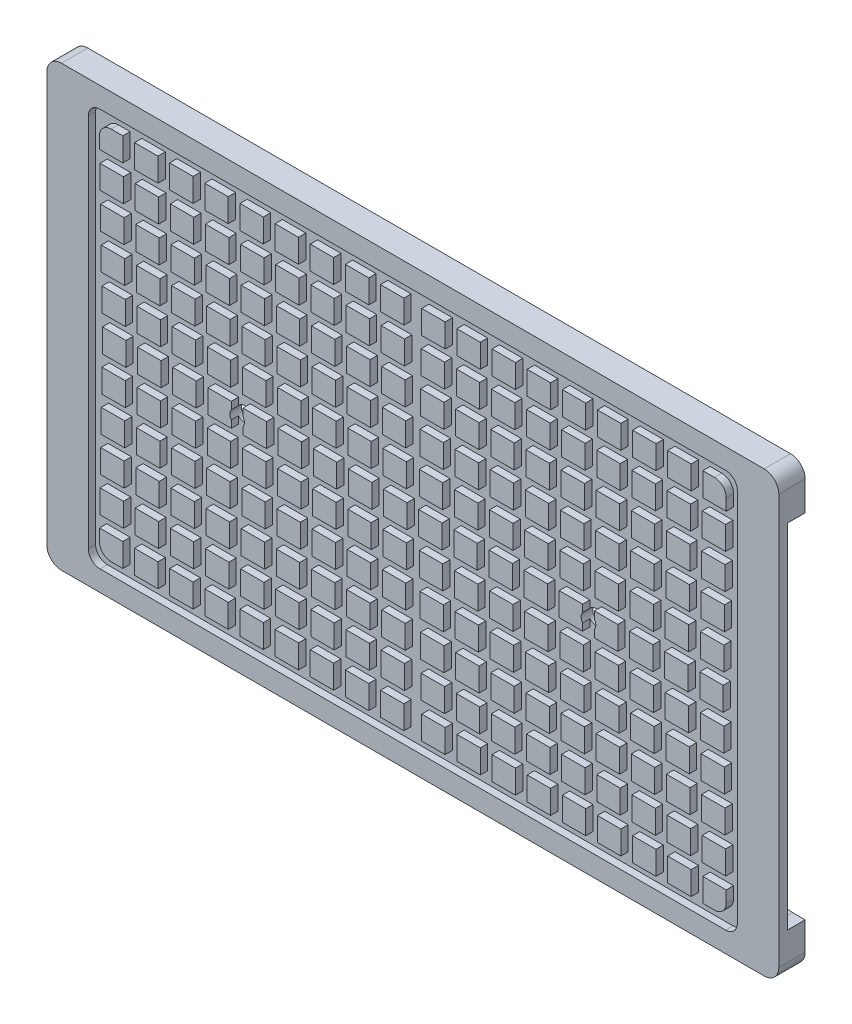
from build123d import *
from build123d.topology import SkipClean

# Parameters (mm, degrees)
EXTRUDE_1_DEPTH     = 9
EXTRUDE_2_DEPTH     = 0.6
CUT_EXTRUDE_1_DEPTH = 6
SKETCH_5_R          = 2.25
CUT_EXTRUDE_2_DEPTH = 15
SKETCH_7_R          = 2.5
CUT_EXTRUDE_3_DEPTH = 15
SKETCH_8_R          = 2.5
CUT_EXTRUDE_4_DEPTH = 5
CUT_EXTRUDE_START   = -2.5
SKETCH_9_W          = 8
SKETCH_9_H          = 8
CUT_EXTRUDE_5_DEPTH = 2.5
SKETCH_10_R         = 1.25
CUT_EXTRUDE_6_DEPTH = 6.5


with BuildPart() as part:
    # 草图2 → 凸台-拉伸1 (new body)
    with BuildSketch(Plane.XY):
        with BuildLine():
            Line((-120, 75), (120, 75))
            ThreePointArc((120, 75), (123.535533906, 73.535533906), (125, 70))
            Line((125, 70), (125, -70))
            ThreePointArc((125, -70), (123.535533906, -73.535533906), (120, -75))
            Line((120, -75), (-120, -75))
            ThreePointArc((-120, -75), (-123.535533906, -73.535533906), (-125, -70))
            Line((-125, -70), (-125, 70))
            ThreePointArc((-125, 70), (-123.535533906, 73.535533906), (-120, 75))
        make_face()
    extrude(amount=EXTRUDE_1_DEPTH)

    # 草图3 → 凸台-拉伸2 (add)
    with BuildSketch(Plane(origin=(0, 0, 0), x_dir=(-1, 0, 0), z_dir=(0, 0, -1))):
        with BuildLine():
            Line((-99.253334042, 67), (99.253334042, 67))
            ThreePointArc((99.253334042, 67), (104.731054073, 64.731054073), (107, 59.253334042))
            Line((107, 59.253334042), (107, -59.253334042))
            ThreePointArc((107, -59.253334042), (104.731054073, -64.731054073), (99.253334042, -67))
            Line((99.253334042, -67), (-99.253334042, -67))
            ThreePointArc((-99.253334042, -67), (-104.731054073, -64.731054073), (-107, -59.253334042))
            Line((-107, -59.253334042), (-107, 59.253334042))
            ThreePointArc((-107, 59.253334042), (-104.731054073, 64.731054073), (-99.253334042, 67))
        make_face()
        with BuildLine():
            Line((-99.253334042, 65), (99.253334042, 65))
            ThreePointArc((99.253334042, 65), (103.31684051, 63.31684051), (105, 59.253334042))
            Line((105, 59.253334042), (105, -59.253334042))
            ThreePointArc((105, -59.253334042), (103.31684051, -63.31684051), (99.253334042, -65))
            Line((99.253334042, -65), (-99.253334042, -65))
            ThreePointArc((-99.253334042, -65), (-103.31684051, -63.31684051), (-105, -59.253334042))
            Line((-105, -59.253334042), (-105, 59.253334042))
            ThreePointArc((-105, 59.253334042), (-103.31684051, 63.31684051), (-99.253334042, 65))
        make_face(mode=Mode.SUBTRACT)
    extrude(amount=EXTRUDE_2_DEPTH)

    # 草图4 → 切除-拉伸1 (cut)
    with BuildSketch(Plane(origin=(0, 0, 0), x_dir=(-1, 0, 0), z_dir=(0, 0, -1))):
        with BuildLine():
            Line((125, -60.380854599), (120.746665958, -60.380854599))
            ThreePointArc((120.746665958, -60.380854599), (116.68315949, -58.697695109), (115, -54.634188641))
            Line((115, -54.634188641), (115, 54.253334042))
            ThreePointArc((115, 54.253334042), (116.68315949, 58.31684051), (120.746665958, 60))
            Line((120.746665958, 60), (125, 60))
            Line((125, 60), (125, -60.380854599))
        make_face()
        with BuildLine():
            Line((-115, -54.634188641), (-115, 54.253334042))
            ThreePointArc((-115, 54.253334042), (-116.68315949, 58.31684051), (-120.746665958, 60))
            Line((-120.746665958, 60), (-125, 60))
            Line((-125, 60), (-125, -60.380854599))
            Line((-125, -60.380854599), (-120.746665958, -60.380854599))
            ThreePointArc((-120.746665958, -60.380854599), (-116.68315949, -58.697695109), (-115, -54.634188641))
        make_face()
    extrude(amount=-CUT_EXTRUDE_1_DEPTH, mode=Mode.SUBTRACT)

    # 草图5 → 切除-拉伸2 (cut)
    with BuildSketch(Plane.XZ.offset(75)):
        with Locations((-15, 3.5)):
            Circle(SKETCH_5_R)
        with Locations((15, 3.5)):
            Circle(SKETCH_5_R)
    extrude(amount=-CUT_EXTRUDE_2_DEPTH, mode=Mode.SUBTRACT)

    # 草图7 → 切除-拉伸3 (cut)
    with BuildSketch(Plane(origin=(0, 0, 0), x_dir=(-1, 0, 0), z_dir=(0, 0, -1))):
        with Locations((60, 0)):
            Circle(SKETCH_7_R)
        with Locations((-60, 0)):
            Circle(SKETCH_7_R)
    extrude(amount=-CUT_EXTRUDE_3_DEPTH, mode=Mode.SUBTRACT)

    # 草图8 → 切除-拉伸4 (cut)
    with BuildSketch(Plane(origin=(0, 0, 0), x_dir=(-1, 0, 0), z_dir=(0, 0, -1))):
        with BuildLine():
            Line((100, 60), (-95, 60))
            ThreePointArc((-95, 60), (-98.535533906, 58.535533906), (-100, 55))
            Line((-100, 55), (-100, -55))
            ThreePointArc((-100, -55), (-98.535533906, -58.535533906), (-95, -60))
            Line((-95, -60), (95, -60))
            ThreePointArc((95, -60), (98.535533906, -58.535533906), (100, -55))
            Line((100, -55), (100, 60))
        make_face()
        with Locations((-60, 0)):
            Circle(SKETCH_8_R, mode=Mode.SUBTRACT)
        with Locations((60, 0)):
            Circle(SKETCH_8_R, mode=Mode.SUBTRACT)
    extrude(amount=-CUT_EXTRUDE_4_DEPTH, mode=Mode.SUBTRACT)

    # 草图9 → 切除-拉伸5 (cut)
    with SkipClean():  # the faces are left unmerged after this step: merging them gives an invalid solid
        with BuildSketch(Plane.XY.offset(9).offset(CUT_EXTRUDE_START)):
            with BuildLine():
                Line((106.837715509, 67.990861709), (-106.837715509, 67.990861709))
                ThreePointArc((-106.837715509, 67.990861709), (-109.666142634, 66.819288834), (-110.837715509, 63.990861709))
                Line((-110.837715509, 63.990861709), (-110.837715509, -63.990861709))
                ThreePointArc((-110.837715509, -63.990861709), (-109.666142634, -66.819288834), (-106.837715509, -67.990861709))
                Line((-106.837715509, -67.990861709), (106.837715509, -67.990861709))
                ThreePointArc((106.837715509, -67.990861709), (109.666142634, -66.819288834), (110.837715509, -63.990861709))
                Line((110.837715509, -63.990861709), (110.837715509, 63.990861709))
                ThreePointArc((110.837715509, 63.990861709), (109.666142634, 66.819288834), (106.837715509, 67.990861709))
            make_face()
            with BuildLine():
                Line((-107.047144386, -59.990861709), (-107.047144386, -55.990861709))
                Line((-107.047144386, -55.990861709), (-99.047144386, -55.990861709))
                Line((-99.047144386, -55.990861709), (-99.047144386, -63.990861709))
                Line((-99.047144386, -63.990861709), (-103.047144386, -63.990861709))
                ThreePointArc((-103.047144386, -63.990861709), (-105.875571511, -62.819288834), (-107.047144386, -59.990861709))
            make_face(mode=Mode.SUBTRACT)
            with Locations((-91.047144386, -59.990861709)):
                Rectangle(SKETCH_9_W, SKETCH_9_H, mode=Mode.SUBTRACT)
            with Locations((-79.047144386, -59.990861709)):
                Rectangle(SKETCH_9_W, SKETCH_9_H, mode=Mode.SUBTRACT)
            with Locations((-67.047144386, -59.990861709)):
                Rectangle(SKETCH_9_W, SKETCH_9_H, mode=Mode.SUBTRACT)
            with Locations((-102.837715509, -47.992689368)):
                Rectangle(SKETCH_9_W, SKETCH_9_H, mode=Mode.SUBTRACT)
            with Locations((-90.837715509, -47.992689368)):
                Rectangle(SKETCH_9_W, SKETCH_9_H, mode=Mode.SUBTRACT)
            with Locations((-102.628286632, -35.994517026)):
                Rectangle(SKETCH_9_W, SKETCH_9_H, mode=Mode.SUBTRACT)
            with Locations((-90.628286632, -35.994517026)):
                Rectangle(SKETCH_9_W, SKETCH_9_H, mode=Mode.SUBTRACT)
            with Locations((-78.837715509, -47.992689368)):
                Rectangle(SKETCH_9_W, SKETCH_9_H, mode=Mode.SUBTRACT)
            with Locations((-66.837715509, -47.992689368)):
                Rectangle(SKETCH_9_W, SKETCH_9_H, mode=Mode.SUBTRACT)
            with Locations((-78.628286632, -35.994517026)):
                Rectangle(SKETCH_9_W, SKETCH_9_H, mode=Mode.SUBTRACT)
            with Locations((-66.628286632, -35.994517026)):
                Rectangle(SKETCH_9_W, SKETCH_9_H, mode=Mode.SUBTRACT)
            with Locations((-55.047144386, -59.990861709)):
                Rectangle(SKETCH_9_W, SKETCH_9_H, mode=Mode.SUBTRACT)
            with Locations((-43.047144386, -59.990861709)):
                Rectangle(SKETCH_9_W, SKETCH_9_H, mode=Mode.SUBTRACT)
            with Locations((-31.047144386, -59.990861709)):
                Rectangle(SKETCH_9_W, SKETCH_9_H, mode=Mode.SUBTRACT)
            with Locations((-19.047144386, -59.990861709)):
                Rectangle(SKETCH_9_W, SKETCH_9_H, mode=Mode.SUBTRACT)
            with Locations((-7.047144386, -59.990861709)):
                Rectangle(SKETCH_9_W, SKETCH_9_H, mode=Mode.SUBTRACT)
            with Locations((-54.837715509, -47.992689368)):
                Rectangle(SKETCH_9_W, SKETCH_9_H, mode=Mode.SUBTRACT)
            with Locations((-42.837715509, -47.992689368)):
                Rectangle(SKETCH_9_W, SKETCH_9_H, mode=Mode.SUBTRACT)
            with Locations((-30.837715509, -47.992689368)):
                Rectangle(SKETCH_9_W, SKETCH_9_H, mode=Mode.SUBTRACT)
            with Locations((-54.628286632, -35.994517026)):
                Rectangle(SKETCH_9_W, SKETCH_9_H, mode=Mode.SUBTRACT)
            with Locations((-42.628286632, -35.994517026)):
                Rectangle(SKETCH_9_W, SKETCH_9_H, mode=Mode.SUBTRACT)
            with Locations((-30.628286632, -35.994517026)):
                Rectangle(SKETCH_9_W, SKETCH_9_H, mode=Mode.SUBTRACT)
            with Locations((-18.837715509, -47.992689368)):
                Rectangle(SKETCH_9_W, SKETCH_9_H, mode=Mode.SUBTRACT)
            with Locations((-6.837715509, -47.992689368)):
                Rectangle(SKETCH_9_W, SKETCH_9_H, mode=Mode.SUBTRACT)
            with Locations((-18.628286632, -35.994517026)):
                Rectangle(SKETCH_9_W, SKETCH_9_H, mode=Mode.SUBTRACT)
            with Locations((-6.628286632, -35.994517026)):
                Rectangle(SKETCH_9_W, SKETCH_9_H, mode=Mode.SUBTRACT)
            with Locations((-102.418857754, -23.996344684)):
                Rectangle(SKETCH_9_W, SKETCH_9_H, mode=Mode.SUBTRACT)
            with Locations((-90.418857754, -23.996344684)):
                Rectangle(SKETCH_9_W, SKETCH_9_H, mode=Mode.SUBTRACT)
            with Locations((-78.418857754, -23.996344684)):
                Rectangle(SKETCH_9_W, SKETCH_9_H, mode=Mode.SUBTRACT)
            with Locations((-66.418857754, -23.996344684)):
                Rectangle(SKETCH_9_W, SKETCH_9_H, mode=Mode.SUBTRACT)
            with Locations((-102.209428877, -11.998172342)):
                Rectangle(SKETCH_9_W, SKETCH_9_H, mode=Mode.SUBTRACT)
            with Locations((-90.209428877, -11.998172342)):
                Rectangle(SKETCH_9_W, SKETCH_9_H, mode=Mode.SUBTRACT)
            with Locations((-102, 0)):
                Rectangle(SKETCH_9_W, SKETCH_9_H, mode=Mode.SUBTRACT)
            with Locations((-90, 0)):
                Rectangle(SKETCH_9_W, SKETCH_9_H, mode=Mode.SUBTRACT)
            with Locations((-78.209428877, -11.998172342)):
                Rectangle(SKETCH_9_W, SKETCH_9_H, mode=Mode.SUBTRACT)
            with Locations((-66.209428877, -11.998172342)):
                Rectangle(SKETCH_9_W, SKETCH_9_H, mode=Mode.SUBTRACT)
            with Locations((-78, 0)):
                Rectangle(SKETCH_9_W, SKETCH_9_H, mode=Mode.SUBTRACT)
            with BuildLine():
                Line((-62, -1.5), (-62, -4))
                Line((-62, -4), (-70, -4))
                Line((-70, -4), (-70, 4))
                Line((-70, 4), (-62, 4))
                Line((-62, 4), (-62, 1.5))
                ThreePointArc((-62, 1.5), (-62.5, 0), (-62, -1.5))
            make_face(mode=Mode.SUBTRACT)
            with Locations((-54.418857754, -23.996344684)):
                Rectangle(SKETCH_9_W, SKETCH_9_H, mode=Mode.SUBTRACT)
            with Locations((-42.418857754, -23.996344684)):
                Rectangle(SKETCH_9_W, SKETCH_9_H, mode=Mode.SUBTRACT)
            with Locations((-30.418857754, -23.996344684)):
                Rectangle(SKETCH_9_W, SKETCH_9_H, mode=Mode.SUBTRACT)
            with Locations((-18.418857754, -23.996344684)):
                Rectangle(SKETCH_9_W, SKETCH_9_H, mode=Mode.SUBTRACT)
            with Locations((-6.418857754, -23.996344684)):
                Rectangle(SKETCH_9_W, SKETCH_9_H, mode=Mode.SUBTRACT)
            with Locations((-54.209428877, -11.998172342)):
                Rectangle(SKETCH_9_W, SKETCH_9_H, mode=Mode.SUBTRACT)
            with Locations((-42.209428877, -11.998172342)):
                Rectangle(SKETCH_9_W, SKETCH_9_H, mode=Mode.SUBTRACT)
            with Locations((-30.209428877, -11.998172342)):
                Rectangle(SKETCH_9_W, SKETCH_9_H, mode=Mode.SUBTRACT)
            with BuildLine():
                Line((-50, 4), (-50, -4))
                Line((-50, -4), (-58, -4))
                Line((-58, -4), (-58, -1.5))
                ThreePointArc((-58, -1.5), (-57.5, 0), (-58, 1.5))
                Line((-58, 1.5), (-58, 4))
                Line((-58, 4), (-50, 4))
            make_face(mode=Mode.SUBTRACT)
            with Locations((-42, 0)):
                Rectangle(SKETCH_9_W, SKETCH_9_H, mode=Mode.SUBTRACT)
            with Locations((-30, 0)):
                Rectangle(SKETCH_9_W, SKETCH_9_H, mode=Mode.SUBTRACT)
            with Locations((-18.209428877, -11.998172342)):
                Rectangle(SKETCH_9_W, SKETCH_9_H, mode=Mode.SUBTRACT)
            with Locations((-6.209428877, -11.998172342)):
                Rectangle(SKETCH_9_W, SKETCH_9_H, mode=Mode.SUBTRACT)
            with Locations((-18, 0)):
                Rectangle(SKETCH_9_W, SKETCH_9_H, mode=Mode.SUBTRACT)
            with Locations((7.047144386, -59.990861709)):
                Rectangle(SKETCH_9_W, SKETCH_9_H, mode=Mode.SUBTRACT)
            with Locations((19.047144386, -59.990861709)):
                Rectangle(SKETCH_9_W, SKETCH_9_H, mode=Mode.SUBTRACT)
            with Locations((31.047144386, -59.990861709)):
                Rectangle(SKETCH_9_W, SKETCH_9_H, mode=Mode.SUBTRACT)
            with Locations((43.047144386, -59.990861709)):
                Rectangle(SKETCH_9_W, SKETCH_9_H, mode=Mode.SUBTRACT)
            with Locations((55.047144386, -59.990861709)):
                Rectangle(SKETCH_9_W, SKETCH_9_H, mode=Mode.SUBTRACT)
            with Locations((6.837715509, -47.992689368)):
                Rectangle(SKETCH_9_W, SKETCH_9_H, mode=Mode.SUBTRACT)
            with Locations((18.837715509, -47.992689368)):
                Rectangle(SKETCH_9_W, SKETCH_9_H, mode=Mode.SUBTRACT)
            with Locations((6.628286632, -35.994517026)):
                Rectangle(SKETCH_9_W, SKETCH_9_H, mode=Mode.SUBTRACT)
            with Locations((18.628286632, -35.994517026)):
                Rectangle(SKETCH_9_W, SKETCH_9_H, mode=Mode.SUBTRACT)
            with Locations((30.837715509, -47.992689368)):
                Rectangle(SKETCH_9_W, SKETCH_9_H, mode=Mode.SUBTRACT)
            with Locations((42.837715509, -47.992689368)):
                Rectangle(SKETCH_9_W, SKETCH_9_H, mode=Mode.SUBTRACT)
            with Locations((54.837715509, -47.992689368)):
                Rectangle(SKETCH_9_W, SKETCH_9_H, mode=Mode.SUBTRACT)
            with Locations((30.628286632, -35.994517026)):
                Rectangle(SKETCH_9_W, SKETCH_9_H, mode=Mode.SUBTRACT)
            with Locations((42.628286632, -35.994517026)):
                Rectangle(SKETCH_9_W, SKETCH_9_H, mode=Mode.SUBTRACT)
            with Locations((54.628286632, -35.994517026)):
                Rectangle(SKETCH_9_W, SKETCH_9_H, mode=Mode.SUBTRACT)
            with Locations((67.047144386, -59.990861709)):
                Rectangle(SKETCH_9_W, SKETCH_9_H, mode=Mode.SUBTRACT)
            with Locations((79.047144386, -59.990861709)):
                Rectangle(SKETCH_9_W, SKETCH_9_H, mode=Mode.SUBTRACT)
            with Locations((91.047144386, -59.990861709)):
                Rectangle(SKETCH_9_W, SKETCH_9_H, mode=Mode.SUBTRACT)
            with BuildLine():
                Line((99.047144386, -63.990861709), (99.047144386, -55.990861709))
                Line((99.047144386, -55.990861709), (107.047144386, -55.990861709))
                Line((107.047144386, -55.990861709), (107.047144386, -59.990861709))
                ThreePointArc((107.047144386, -59.990861709), (105.875571511, -62.819288834), (103.047144386, -63.990861709))
                Line((103.047144386, -63.990861709), (99.047144386, -63.990861709))
            make_face(mode=Mode.SUBTRACT)
            with Locations((66.837715509, -47.992689368)):
                Rectangle(SKETCH_9_W, SKETCH_9_H, mode=Mode.SUBTRACT)
            with Locations((78.837715509, -47.992689368)):
                Rectangle(SKETCH_9_W, SKETCH_9_H, mode=Mode.SUBTRACT)
            with Locations((66.628286632, -35.994517026)):
                Rectangle(SKETCH_9_W, SKETCH_9_H, mode=Mode.SUBTRACT)
            with Locations((78.628286632, -35.994517026)):
                Rectangle(SKETCH_9_W, SKETCH_9_H, mode=Mode.SUBTRACT)
            with Locations((90.837715509, -47.992689368)):
                Rectangle(SKETCH_9_W, SKETCH_9_H, mode=Mode.SUBTRACT)
            with Locations((102.837715509, -47.992689368)):
                Rectangle(SKETCH_9_W, SKETCH_9_H, mode=Mode.SUBTRACT)
            with Locations((90.628286632, -35.994517026)):
                Rectangle(SKETCH_9_W, SKETCH_9_H, mode=Mode.SUBTRACT)
            with Locations((102.628286632, -35.994517026)):
                Rectangle(SKETCH_9_W, SKETCH_9_H, mode=Mode.SUBTRACT)
            with Locations((6.418857754, -23.996344684)):
                Rectangle(SKETCH_9_W, SKETCH_9_H, mode=Mode.SUBTRACT)
            with Locations((18.418857754, -23.996344684)):
                Rectangle(SKETCH_9_W, SKETCH_9_H, mode=Mode.SUBTRACT)
            with Locations((30.418857754, -23.996344684)):
                Rectangle(SKETCH_9_W, SKETCH_9_H, mode=Mode.SUBTRACT)
            with Locations((42.418857754, -23.996344684)):
                Rectangle(SKETCH_9_W, SKETCH_9_H, mode=Mode.SUBTRACT)
            with Locations((54.418857754, -23.996344684)):
                Rectangle(SKETCH_9_W, SKETCH_9_H, mode=Mode.SUBTRACT)
            with Locations((6.209428877, -11.998172342)):
                Rectangle(SKETCH_9_W, SKETCH_9_H, mode=Mode.SUBTRACT)
            with Locations((18.209428877, -11.998172342)):
                Rectangle(SKETCH_9_W, SKETCH_9_H, mode=Mode.SUBTRACT)
            with Locations((18, 0)):
                Rectangle(SKETCH_9_W, SKETCH_9_H, mode=Mode.SUBTRACT)
            with Locations((30.209428877, -11.998172342)):
                Rectangle(SKETCH_9_W, SKETCH_9_H, mode=Mode.SUBTRACT)
            with Locations((42.209428877, -11.998172342)):
                Rectangle(SKETCH_9_W, SKETCH_9_H, mode=Mode.SUBTRACT)
            with Locations((54.209428877, -11.998172342)):
                Rectangle(SKETCH_9_W, SKETCH_9_H, mode=Mode.SUBTRACT)
            with Locations((30, 0)):
                Rectangle(SKETCH_9_W, SKETCH_9_H, mode=Mode.SUBTRACT)
            with Locations((42, 0)):
                Rectangle(SKETCH_9_W, SKETCH_9_H, mode=Mode.SUBTRACT)
            with BuildLine():
                Line((58, -1.5), (58, -4))
                Line((58, -4), (50, -4))
                Line((50, -4), (50, 4))
                Line((50, 4), (58, 4))
                Line((58, 4), (58, 1.5))
                ThreePointArc((58, 1.5), (57.5, 0), (58, -1.5))
            make_face(mode=Mode.SUBTRACT)
            with Locations((66.418857754, -23.996344684)):
                Rectangle(SKETCH_9_W, SKETCH_9_H, mode=Mode.SUBTRACT)
            with Locations((78.418857754, -23.996344684)):
                Rectangle(SKETCH_9_W, SKETCH_9_H, mode=Mode.SUBTRACT)
            with Locations((90.418857754, -23.996344684)):
                Rectangle(SKETCH_9_W, SKETCH_9_H, mode=Mode.SUBTRACT)
            with Locations((102.418857754, -23.996344684)):
                Rectangle(SKETCH_9_W, SKETCH_9_H, mode=Mode.SUBTRACT)
            with Locations((66.209428877, -11.998172342)):
                Rectangle(SKETCH_9_W, SKETCH_9_H, mode=Mode.SUBTRACT)
            with Locations((78.209428877, -11.998172342)):
                Rectangle(SKETCH_9_W, SKETCH_9_H, mode=Mode.SUBTRACT)
            with BuildLine():
                Line((70, 4), (70, -4))
                Line((70, -4), (62, -4))
                Line((62, -4), (62, -1.5))
                ThreePointArc((62, -1.5), (62.5, 0), (62, 1.5))
                Line((62, 1.5), (62, 4))
                Line((62, 4), (70, 4))
            make_face(mode=Mode.SUBTRACT)
            with Locations((78, 0)):
                Rectangle(SKETCH_9_W, SKETCH_9_H, mode=Mode.SUBTRACT)
            with Locations((90.209428877, -11.998172342)):
                Rectangle(SKETCH_9_W, SKETCH_9_H, mode=Mode.SUBTRACT)
            with Locations((102.209428877, -11.998172342)):
                Rectangle(SKETCH_9_W, SKETCH_9_H, mode=Mode.SUBTRACT)
            with Locations((90, 0)):
                Rectangle(SKETCH_9_W, SKETCH_9_H, mode=Mode.SUBTRACT)
            with Locations((102, 0)):
                Rectangle(SKETCH_9_W, SKETCH_9_H, mode=Mode.SUBTRACT)
            with Locations((-102.209428877, 11.998172342)):
                Rectangle(SKETCH_9_W, SKETCH_9_H, mode=Mode.SUBTRACT)
            with Locations((-90.209428877, 11.998172342)):
                Rectangle(SKETCH_9_W, SKETCH_9_H, mode=Mode.SUBTRACT)
            with Locations((-78.209428877, 11.998172342)):
                Rectangle(SKETCH_9_W, SKETCH_9_H, mode=Mode.SUBTRACT)
            with Locations((-66.209428877, 11.998172342)):
                Rectangle(SKETCH_9_W, SKETCH_9_H, mode=Mode.SUBTRACT)
            with Locations((-102.418857754, 23.996344684)):
                Rectangle(SKETCH_9_W, SKETCH_9_H, mode=Mode.SUBTRACT)
            with Locations((-90.418857754, 23.996344684)):
                Rectangle(SKETCH_9_W, SKETCH_9_H, mode=Mode.SUBTRACT)
            with Locations((-78.418857754, 23.996344684)):
                Rectangle(SKETCH_9_W, SKETCH_9_H, mode=Mode.SUBTRACT)
            with Locations((-66.418857754, 23.996344684)):
                Rectangle(SKETCH_9_W, SKETCH_9_H, mode=Mode.SUBTRACT)
            with Locations((-54.209428877, 11.998172342)):
                Rectangle(SKETCH_9_W, SKETCH_9_H, mode=Mode.SUBTRACT)
            with Locations((-42.209428877, 11.998172342)):
                Rectangle(SKETCH_9_W, SKETCH_9_H, mode=Mode.SUBTRACT)
            with Locations((-30.209428877, 11.998172342)):
                Rectangle(SKETCH_9_W, SKETCH_9_H, mode=Mode.SUBTRACT)
            with Locations((-6, 0)):
                Rectangle(SKETCH_9_W, SKETCH_9_H, mode=Mode.SUBTRACT)
            with Locations((-18.209428877, 11.998172342)):
                Rectangle(SKETCH_9_W, SKETCH_9_H, mode=Mode.SUBTRACT)
            with Locations((-6.209428877, 11.998172342)):
                Rectangle(SKETCH_9_W, SKETCH_9_H, mode=Mode.SUBTRACT)
            with Locations((-54.418857754, 23.996344684)):
                Rectangle(SKETCH_9_W, SKETCH_9_H, mode=Mode.SUBTRACT)
            with Locations((-42.418857754, 23.996344684)):
                Rectangle(SKETCH_9_W, SKETCH_9_H, mode=Mode.SUBTRACT)
            with Locations((-30.418857754, 23.996344684)):
                Rectangle(SKETCH_9_W, SKETCH_9_H, mode=Mode.SUBTRACT)
            with Locations((-18.418857754, 23.996344684)):
                Rectangle(SKETCH_9_W, SKETCH_9_H, mode=Mode.SUBTRACT)
            with Locations((-6.418857754, 23.996344684)):
                Rectangle(SKETCH_9_W, SKETCH_9_H, mode=Mode.SUBTRACT)
            with Locations((-102.628286632, 35.994517026)):
                Rectangle(SKETCH_9_W, SKETCH_9_H, mode=Mode.SUBTRACT)
            with Locations((-90.628286632, 35.994517026)):
                Rectangle(SKETCH_9_W, SKETCH_9_H, mode=Mode.SUBTRACT)
            with Locations((-102.837715509, 47.992689368)):
                Rectangle(SKETCH_9_W, SKETCH_9_H, mode=Mode.SUBTRACT)
            with Locations((-90.837715509, 47.992689368)):
                Rectangle(SKETCH_9_W, SKETCH_9_H, mode=Mode.SUBTRACT)
            with Locations((-78.628286632, 35.994517026)):
                Rectangle(SKETCH_9_W, SKETCH_9_H, mode=Mode.SUBTRACT)
            with Locations((-66.628286632, 35.994517026)):
                Rectangle(SKETCH_9_W, SKETCH_9_H, mode=Mode.SUBTRACT)
            with Locations((-78.837715509, 47.992689368)):
                Rectangle(SKETCH_9_W, SKETCH_9_H, mode=Mode.SUBTRACT)
            with Locations((-66.837715509, 47.992689368)):
                Rectangle(SKETCH_9_W, SKETCH_9_H, mode=Mode.SUBTRACT)
            with BuildLine():
                Line((-99.047144386, 63.990861709), (-99.047144386, 55.990861709))
                Line((-99.047144386, 55.990861709), (-107.047144386, 55.990861709))
                Line((-107.047144386, 55.990861709), (-107.047144386, 59.990861709))
                ThreePointArc((-107.047144386, 59.990861709), (-105.875571511, 62.819288834), (-103.047144386, 63.990861709))
                Line((-103.047144386, 63.990861709), (-99.047144386, 63.990861709))
            make_face(mode=Mode.SUBTRACT)
            with Locations((-91.047144386, 59.990861709)):
                Rectangle(SKETCH_9_W, SKETCH_9_H, mode=Mode.SUBTRACT)
            with Locations((-79.047144386, 59.990861709)):
                Rectangle(SKETCH_9_W, SKETCH_9_H, mode=Mode.SUBTRACT)
            with Locations((-67.047144386, 59.990861709)):
                Rectangle(SKETCH_9_W, SKETCH_9_H, mode=Mode.SUBTRACT)
            with Locations((-54.628286632, 35.994517026)):
                Rectangle(SKETCH_9_W, SKETCH_9_H, mode=Mode.SUBTRACT)
            with Locations((-42.628286632, 35.994517026)):
                Rectangle(SKETCH_9_W, SKETCH_9_H, mode=Mode.SUBTRACT)
            with Locations((-30.628286632, 35.994517026)):
                Rectangle(SKETCH_9_W, SKETCH_9_H, mode=Mode.SUBTRACT)
            with Locations((-54.837715509, 47.992689368)):
                Rectangle(SKETCH_9_W, SKETCH_9_H, mode=Mode.SUBTRACT)
            with Locations((-42.837715509, 47.992689368)):
                Rectangle(SKETCH_9_W, SKETCH_9_H, mode=Mode.SUBTRACT)
            with Locations((-30.837715509, 47.992689368)):
                Rectangle(SKETCH_9_W, SKETCH_9_H, mode=Mode.SUBTRACT)
            with Locations((-18.628286632, 35.994517026)):
                Rectangle(SKETCH_9_W, SKETCH_9_H, mode=Mode.SUBTRACT)
            with Locations((-6.628286632, 35.994517026)):
                Rectangle(SKETCH_9_W, SKETCH_9_H, mode=Mode.SUBTRACT)
            with Locations((-18.837715509, 47.992689368)):
                Rectangle(SKETCH_9_W, SKETCH_9_H, mode=Mode.SUBTRACT)
            with Locations((-6.837715509, 47.992689368)):
                Rectangle(SKETCH_9_W, SKETCH_9_H, mode=Mode.SUBTRACT)
            with Locations((-55.047144386, 59.990861709)):
                Rectangle(SKETCH_9_W, SKETCH_9_H, mode=Mode.SUBTRACT)
            with Locations((-43.047144386, 59.990861709)):
                Rectangle(SKETCH_9_W, SKETCH_9_H, mode=Mode.SUBTRACT)
            with Locations((-31.047144386, 59.990861709)):
                Rectangle(SKETCH_9_W, SKETCH_9_H, mode=Mode.SUBTRACT)
            with Locations((-19.047144386, 59.990861709)):
                Rectangle(SKETCH_9_W, SKETCH_9_H, mode=Mode.SUBTRACT)
            with Locations((-7.047144386, 59.990861709)):
                Rectangle(SKETCH_9_W, SKETCH_9_H, mode=Mode.SUBTRACT)
            with Locations((6, 0)):
                Rectangle(SKETCH_9_W, SKETCH_9_H, mode=Mode.SUBTRACT)
            with Locations((6.209428877, 11.998172342)):
                Rectangle(SKETCH_9_W, SKETCH_9_H, mode=Mode.SUBTRACT)
            with Locations((18.209428877, 11.998172342)):
                Rectangle(SKETCH_9_W, SKETCH_9_H, mode=Mode.SUBTRACT)
            with Locations((30.209428877, 11.998172342)):
                Rectangle(SKETCH_9_W, SKETCH_9_H, mode=Mode.SUBTRACT)
            with Locations((42.209428877, 11.998172342)):
                Rectangle(SKETCH_9_W, SKETCH_9_H, mode=Mode.SUBTRACT)
            with Locations((54.209428877, 11.998172342)):
                Rectangle(SKETCH_9_W, SKETCH_9_H, mode=Mode.SUBTRACT)
            with Locations((6.418857754, 23.996344684)):
                Rectangle(SKETCH_9_W, SKETCH_9_H, mode=Mode.SUBTRACT)
            with Locations((18.418857754, 23.996344684)):
                Rectangle(SKETCH_9_W, SKETCH_9_H, mode=Mode.SUBTRACT)
            with Locations((30.418857754, 23.996344684)):
                Rectangle(SKETCH_9_W, SKETCH_9_H, mode=Mode.SUBTRACT)
            with Locations((42.418857754, 23.996344684)):
                Rectangle(SKETCH_9_W, SKETCH_9_H, mode=Mode.SUBTRACT)
            with Locations((54.418857754, 23.996344684)):
                Rectangle(SKETCH_9_W, SKETCH_9_H, mode=Mode.SUBTRACT)
            with Locations((66.209428877, 11.998172342)):
                Rectangle(SKETCH_9_W, SKETCH_9_H, mode=Mode.SUBTRACT)
            with Locations((78.209428877, 11.998172342)):
                Rectangle(SKETCH_9_W, SKETCH_9_H, mode=Mode.SUBTRACT)
            with Locations((90.209428877, 11.998172342)):
                Rectangle(SKETCH_9_W, SKETCH_9_H, mode=Mode.SUBTRACT)
            with Locations((102.209428877, 11.998172342)):
                Rectangle(SKETCH_9_W, SKETCH_9_H, mode=Mode.SUBTRACT)
            with Locations((66.418857754, 23.996344684)):
                Rectangle(SKETCH_9_W, SKETCH_9_H, mode=Mode.SUBTRACT)
            with Locations((78.418857754, 23.996344684)):
                Rectangle(SKETCH_9_W, SKETCH_9_H, mode=Mode.SUBTRACT)
            with Locations((90.418857754, 23.996344684)):
                Rectangle(SKETCH_9_W, SKETCH_9_H, mode=Mode.SUBTRACT)
            with Locations((102.418857754, 23.996344684)):
                Rectangle(SKETCH_9_W, SKETCH_9_H, mode=Mode.SUBTRACT)
            with Locations((6.628286632, 35.994517026)):
                Rectangle(SKETCH_9_W, SKETCH_9_H, mode=Mode.SUBTRACT)
            with Locations((18.628286632, 35.994517026)):
                Rectangle(SKETCH_9_W, SKETCH_9_H, mode=Mode.SUBTRACT)
            with Locations((6.837715509, 47.992689368)):
                Rectangle(SKETCH_9_W, SKETCH_9_H, mode=Mode.SUBTRACT)
            with Locations((18.837715509, 47.992689368)):
                Rectangle(SKETCH_9_W, SKETCH_9_H, mode=Mode.SUBTRACT)
            with Locations((30.628286632, 35.994517026)):
                Rectangle(SKETCH_9_W, SKETCH_9_H, mode=Mode.SUBTRACT)
            with Locations((42.628286632, 35.994517026)):
                Rectangle(SKETCH_9_W, SKETCH_9_H, mode=Mode.SUBTRACT)
            with Locations((54.628286632, 35.994517026)):
                Rectangle(SKETCH_9_W, SKETCH_9_H, mode=Mode.SUBTRACT)
            with Locations((30.837715509, 47.992689368)):
                Rectangle(SKETCH_9_W, SKETCH_9_H, mode=Mode.SUBTRACT)
            with Locations((42.837715509, 47.992689368)):
                Rectangle(SKETCH_9_W, SKETCH_9_H, mode=Mode.SUBTRACT)
            with Locations((54.837715509, 47.992689368)):
                Rectangle(SKETCH_9_W, SKETCH_9_H, mode=Mode.SUBTRACT)
            with Locations((7.047144386, 59.990861709)):
                Rectangle(SKETCH_9_W, SKETCH_9_H, mode=Mode.SUBTRACT)
            with Locations((19.047144386, 59.990861709)):
                Rectangle(SKETCH_9_W, SKETCH_9_H, mode=Mode.SUBTRACT)
            with Locations((31.047144386, 59.990861709)):
                Rectangle(SKETCH_9_W, SKETCH_9_H, mode=Mode.SUBTRACT)
            with Locations((43.047144386, 59.990861709)):
                Rectangle(SKETCH_9_W, SKETCH_9_H, mode=Mode.SUBTRACT)
            with Locations((55.047144386, 59.990861709)):
                Rectangle(SKETCH_9_W, SKETCH_9_H, mode=Mode.SUBTRACT)
            with Locations((66.628286632, 35.994517026)):
                Rectangle(SKETCH_9_W, SKETCH_9_H, mode=Mode.SUBTRACT)
            with Locations((78.628286632, 35.994517026)):
                Rectangle(SKETCH_9_W, SKETCH_9_H, mode=Mode.SUBTRACT)
            with Locations((66.837715509, 47.992689368)):
                Rectangle(SKETCH_9_W, SKETCH_9_H, mode=Mode.SUBTRACT)
            with Locations((78.837715509, 47.992689368)):
                Rectangle(SKETCH_9_W, SKETCH_9_H, mode=Mode.SUBTRACT)
            with Locations((90.628286632, 35.994517026)):
                Rectangle(SKETCH_9_W, SKETCH_9_H, mode=Mode.SUBTRACT)
            with Locations((102.628286632, 35.994517026)):
                Rectangle(SKETCH_9_W, SKETCH_9_H, mode=Mode.SUBTRACT)
            with Locations((90.837715509, 47.992689368)):
                Rectangle(SKETCH_9_W, SKETCH_9_H, mode=Mode.SUBTRACT)
            with Locations((102.837715509, 47.992689368)):
                Rectangle(SKETCH_9_W, SKETCH_9_H, mode=Mode.SUBTRACT)
            with Locations((67.047144386, 59.990861709)):
                Rectangle(SKETCH_9_W, SKETCH_9_H, mode=Mode.SUBTRACT)
            with Locations((79.047144386, 59.990861709)):
                Rectangle(SKETCH_9_W, SKETCH_9_H, mode=Mode.SUBTRACT)
            with Locations((91.047144386, 59.990861709)):
                Rectangle(SKETCH_9_W, SKETCH_9_H, mode=Mode.SUBTRACT)
            with BuildLine():
                Line((107.047144386, 59.990861709), (107.047144386, 55.990861709))
                Line((107.047144386, 55.990861709), (99.047144386, 55.990861709))
                Line((99.047144386, 55.990861709), (99.047144386, 63.990861709))
                Line((99.047144386, 63.990861709), (103.047144386, 63.990861709))
                ThreePointArc((103.047144386, 63.990861709), (105.875571511, 62.819288834), (107.047144386, 59.990861709))
            make_face(mode=Mode.SUBTRACT)
        extrude(amount=CUT_EXTRUDE_5_DEPTH, mode=Mode.SUBTRACT)

    # 草图10 → 切除-拉伸6 (cut)
    with SkipClean():  # the faces are left unmerged after this step: merging them gives an invalid solid
        with BuildSketch(Plane(origin=(0, 0, 0), x_dir=(-1, 0, 0), z_dir=(0, 0, -1))):
            with Locations((120, -70)):
                Circle(SKETCH_10_R)
            with Locations((60.164669271, -71)):
                Circle(SKETCH_10_R)
            with Locations((0, -71)):
                Circle(SKETCH_10_R)
            with Locations((-60.164669271, -71)):
                Circle(SKETCH_10_R)
            with Locations((-120, -70)):
                Circle(SKETCH_10_R)
            with Locations((-120, 70)):
                Circle(SKETCH_10_R)
            with Locations((-60.164669271, 71)):
                Circle(SKETCH_10_R)
            with Locations((0, 71)):
                Circle(SKETCH_10_R)
            with Locations((60.164669271, 71)):
                Circle(SKETCH_10_R)
            with Locations((120, 70)):
                Circle(SKETCH_10_R)
        extrude(amount=-CUT_EXTRUDE_6_DEPTH, mode=Mode.SUBTRACT)


solid = part.part
